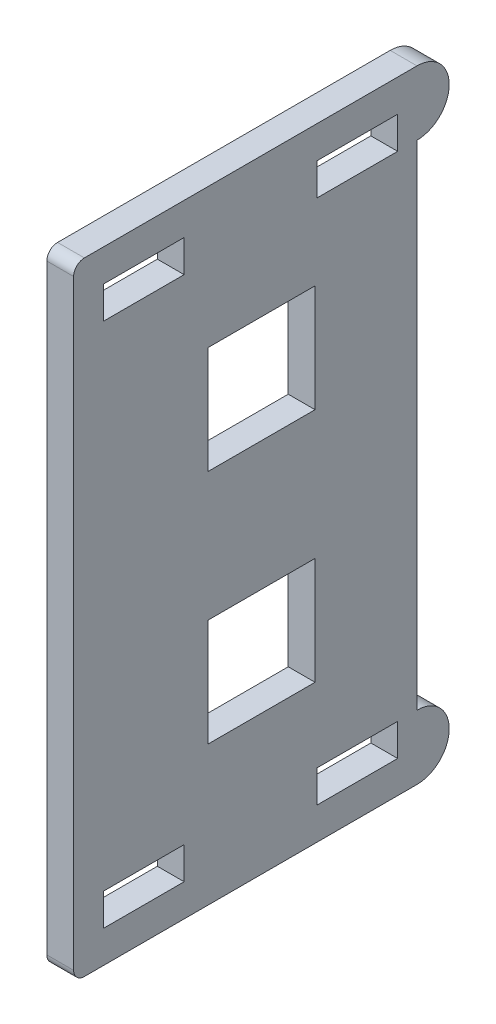
from build123d import *

# Parameters (mm, degrees)
SKETCH_2_W          = 35
SKETCH_2_H          = 58
EXTRUDE_1_DEPTH     = 2.5
SKETCH_4_W          = 7.5
SKETCH_4_H          = 3
CUT_EXTRUDE_1_DEPTH = 34.963215395
CUT_EXTRUDE_2_DEPTH = 34.963215395
SKETCH_7_W          = 10
SKETCH_7_H          = 10
CUT_EXTRUDE_3_DEPTH = 34.963215395
FILLET_1_R          = 1


with BuildPart() as part:
    # 草图2 → 凸台-拉伸1 (new body)
    with BuildSketch(Plane(origin=(0, 0, 0), x_dir=(0, 0, -1), z_dir=(1, 0, 0))):
        Rectangle(SKETCH_2_W, SKETCH_2_H)
    extrude(amount=EXTRUDE_1_DEPTH)

    # 草图4 → 切除-拉伸1 (cut, through all)
    with BuildSketch(Plane.ZY):
        with Locations((-8.95, 24.5)):
            Rectangle(SKETCH_4_W, SKETCH_4_H)
        with Locations((10.95, 24.5)):
            Rectangle(SKETCH_4_W, SKETCH_4_H)
        with Locations((-8.95, -24.5)):
            Rectangle(SKETCH_4_W, SKETCH_4_H)
        with Locations((10.95, -24.5)):
            Rectangle(SKETCH_4_W, SKETCH_4_H)
    extrude(amount=-CUT_EXTRUDE_1_DEPTH, mode=Mode.SUBTRACT)

    # 草图5 → 切除-拉伸2 (cut, through all)
    with BuildSketch(Plane.ZY):
        with BuildLine():
            ThreePointArc((-14.5, -29), (-16.621320344, -28.121320344), (-17.5, -26))
            Line((-17.5, -26), (-17.5, -29))
            Line((-17.5, -29), (-14.5, -29))
        make_face()
        with BuildLine():
            Line((-17.5, 29), (-17.5, 26.000000007))
            ThreePointArc((-17.5, 26.000000007), (-16.621320341, 28.121320346), (-14.5, 29))
            Line((-14.5, 29), (-17.5, 29))
        make_face()
        with BuildLine():
            ThreePointArc((-14.5, 23), (-16.621320346, 23.878679659), (-17.5, 26.000000007))
            Line((-17.5, 26.000000007), (-17.5, -26))
            ThreePointArc((-17.5, -26), (-16.621320344, -23.878679656), (-14.5, -23))
            Line((-14.5, -23), (-14.5, 23))
        make_face()
    extrude(amount=-CUT_EXTRUDE_2_DEPTH, mode=Mode.SUBTRACT)

    # 草图7 → 切除-拉伸3 (cut, through all)
    with BuildSketch(Plane.ZY):
        with Locations((0, -11)):
            Rectangle(SKETCH_7_W, SKETCH_7_H)
        with Locations((0, 11)):
            Rectangle(SKETCH_7_W, SKETCH_7_H)
    extrude(amount=-CUT_EXTRUDE_3_DEPTH, mode=Mode.SUBTRACT)

    # 圆角1
    fillet_1_edges = [part.edges().sort_by_distance(p)[0] for p in [
        (1.25, -29, 17.5),
        (1.25, 29, 17.5),
    ]]
    fillet(fillet_1_edges, radius=FILLET_1_R)


solid = part.part
